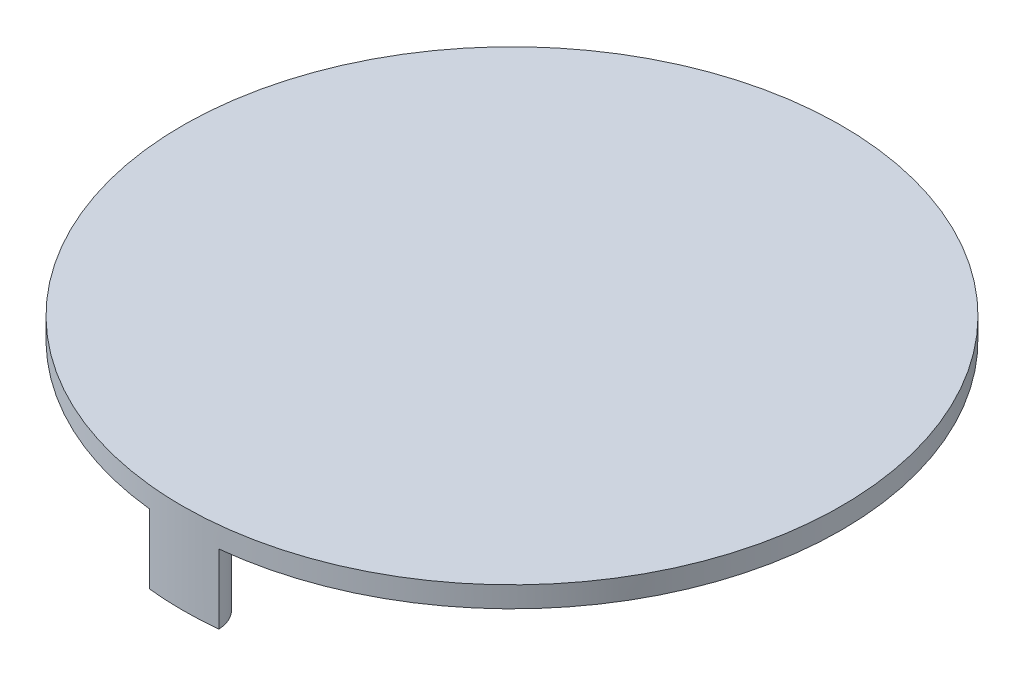
from build123d import *

# Parameters (mm, degrees)
SKETCH2_R           = 47.5
BOSS_EXTRUDE1_DEPTH = 3
BOSS_EXTRUDE2_START = 10
BOSS_EXTRUDE2_DEPTH = 10


with BuildPart() as part:
    # Sketch2 → Boss-Extrude1 (new body)
    with BuildSketch(Plane(origin=(0, 0, 0), x_dir=(1, 0, 0), z_dir=(0, 1, 0))):
        Circle(SKETCH2_R)
    extrude(amount=BOSS_EXTRUDE1_DEPTH)

    # Sketch4 → Boss-Extrude2 (add)
    with BuildSketch(Plane.XZ.offset(BOSS_EXTRUDE2_START)):
        with BuildLine():
            ThreePointArc((-4.99306999, 47.236842105), (0, 42.5), (4.99306999, 47.236842105))
            ThreePointArc((4.99306999, 47.236842105), (0, 47.5), (-4.99306999, 47.236842105))
        make_face()
    extrude(amount=-BOSS_EXTRUDE2_DEPTH)


solid = part.part
